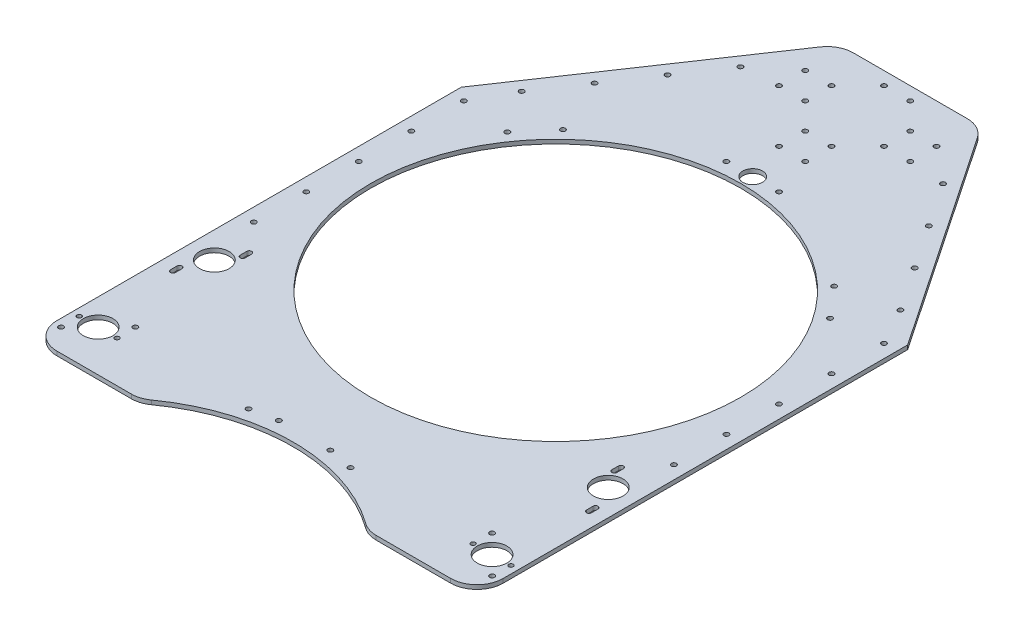
from build123d import *

# Parameters (mm, degrees)
SKETCH1_W           = 431.8
SKETCH1_H           = 685.8
BOSS_EXTRUDE1_DEPTH = 4
SKETCH2_R           = 14.3129
SKETCH2_R_2         = 2.38125
SKETCH2_R_3         = 2.159
CUT_EXTRUDE1_DEPTH  = 406.227368276
SKETCH6_R           = 179.07
CUT_EXTRUDE4_DEPTH  = 406.227368276
SKETCH8_R           = 9.525
SKETCH8_R_2         = 2.38125
CUT_EXTRUDE6_DEPTH  = 406.227368276
FILLET2_R           = 25.4
SKETCH11_R          = 2.38125
CUT_EXTRUDE9_DEPTH  = 406.227368276
SKETCH13_R          = 2.38125
SKETCH13_R_2        = 2.466421692
SKETCH13_R_3        = 2.307769972
CUT_EXTRUDE10_DEPTH = 406.227368276
SKETCH16_W          = 431.8
SKETCH16_H          = 50.8
CUT_EXTRUDE13_DEPTH = 406.227368276
SKETCH17_R          = 177.8
SKETCH17_R_2        = 2.38125
CUT_EXTRUDE14_DEPTH = 406.227368276
FILLET3_R           = 25.4
SKETCH18_R          = 2.38125
CUT_EXTRUDE15_DEPTH = 406.227368276
CHAMFER1_SIZE       = 147.32
CHAMFER1_SIZE2      = 218.410881881
CHAMFER2_SIZE       = 147.32
CHAMFER2_SIZE2      = 218.410881881
FILLET4_R           = 25.4
SKETCH19_R          = 2.38125
CUT_EXTRUDE16_DEPTH = 406.227368276


with BuildPart() as part:
    # Sketch1 → Boss-Extrude1 (new body)
    with BuildSketch(Plane(origin=(0, 0, 0), x_dir=(1, 0, 0), z_dir=(0, 1, 0))):
        Rectangle(SKETCH1_W, SKETCH1_H)
    extrude(amount=BOSS_EXTRUDE1_DEPTH)

    # Sketch2 → Cut-Extrude1 (cut, through all)
    with BuildSketch(Plane(origin=(0, 4, 0), x_dir=(1, 0, 0), z_dir=(0, 1, 0))):
        with BuildLine():
            Line((198.853253848, -213.520217791), (198.853253848, -219.870217791))
            ThreePointArc((198.853253848, -219.870217791), (201.234503848, -222.251467791), (203.615753848, -219.870217791))
            Line((203.615753848, -219.870217791), (203.615753848, -213.520217791))
            ThreePointArc((203.615753848, -213.520217791), (201.234503848, -211.138967791), (198.853253848, -213.520217791))
        make_face()
        with BuildLine():
            Line((177.384246152, -167.479782209), (177.384246152, -173.829782209))
            ThreePointArc((177.384246152, -173.829782209), (179.765496152, -176.211032209), (182.146746152, -173.829782209))
            Line((182.146746152, -173.829782209), (182.146746152, -167.479782209))
            ThreePointArc((182.146746152, -167.479782209), (179.765496152, -165.098532209), (177.384246152, -167.479782209))
        make_face()
        with BuildLine():
            Line((-203.615753848, -213.520217791), (-203.615753848, -219.870217791))
            ThreePointArc((-203.615753848, -219.870217791), (-201.234503848, -222.251467791), (-198.853253848, -219.870217791))
            Line((-198.853253848, -219.870217791), (-198.853253848, -213.520217791))
            ThreePointArc((-198.853253848, -213.520217791), (-201.234503848, -211.138967791), (-203.615753848, -213.520217791))
        make_face()
        with BuildLine():
            Line((-182.146746152, -167.479782209), (-182.146746152, -173.829782209))
            ThreePointArc((-182.146746152, -173.829782209), (-179.765496152, -176.211032209), (-177.384246152, -173.829782209))
            Line((-177.384246152, -173.829782209), (-177.384246152, -167.479782209))
            ThreePointArc((-177.384246152, -167.479782209), (-179.765496152, -165.098532209), (-182.146746152, -167.479782209))
        make_face()
        with Locations((-190.5, -302.895)):
            Circle(SKETCH2_R)
        with Locations((-190.5, -190.5)):
            Circle(SKETCH2_R)
        with Locations((190.5, -190.5)):
            Circle(SKETCH2_R)
        with Locations((-208.460512242, -320.855512242)):
            Circle(SKETCH2_R_2)
        with Locations((-172.539487758, -284.934487758)):
            Circle(SKETCH2_R_2)
        with Locations((172.539487758, -284.934487758)):
            Circle(SKETCH2_R_2)
        with Locations((208.460512242, -320.855512242)):
            Circle(SKETCH2_R_2)
        with Locations((190.5, -302.895)):
            Circle(SKETCH2_R)
        with Locations((208.788, -302.895)):
            Circle(SKETCH2_R_3)
        with Locations((172.212, -302.895)):
            Circle(SKETCH2_R_3)
        with Locations((-172.212, -302.895)):
            Circle(SKETCH2_R_3)
        with Locations((-208.788, -302.895)):
            Circle(SKETCH2_R_3)
    extrude(amount=-CUT_EXTRUDE1_DEPTH, mode=Mode.SUBTRACT)

    # Sketch6 → Cut-Extrude4 (cut, through all)
    with BuildSketch(Plane(origin=(0, 4, 0), x_dir=(1, 0, 0), z_dir=(0, 1, 0))):
        with Locations((0, -50.8)):
            Circle(SKETCH6_R)
    extrude(amount=-CUT_EXTRUDE4_DEPTH, mode=Mode.SUBTRACT)

    # Sketch8 → Cut-Extrude6 (cut, through all)
    with BuildSketch(Plane(origin=(0, 4, 0), x_dir=(1, 0, 0), z_dir=(0, 1, 0))):
        with Locations((0, 139.7)):
            Circle(SKETCH8_R)
        with Locations((25.4, 139.7)):
            Circle(SKETCH8_R_2)
        with Locations((-25.4, 139.7)):
            Circle(SKETCH8_R_2)
    extrude(amount=-CUT_EXTRUDE6_DEPTH, mode=Mode.SUBTRACT)

    # Fillet2
    fillet2_edges = [part.edges().sort_by_distance(p)[0] for p in [
        (215.9, 2, 342.9),
        (-215.9, 2, 342.9),
    ]]
    fillet(fillet2_edges, radius=FILLET2_R)

    # Sketch11 → Cut-Extrude9 (cut, through all)
    with BuildSketch(Plane(origin=(0, 4, 0), x_dir=(1, 0, 0), z_dir=(0, 1, 0))):
        with Locations((156.048464437, 58.466311125)):
            Circle(SKETCH11_R)
        with Locations((131.183773775, 87.334237241)):
            Circle(SKETCH11_R)
        with Locations((-131.183773775, 87.334237241)):
            Circle(SKETCH11_R)
        with Locations((-156.048464437, 58.466311125)):
            Circle(SKETCH11_R)
    extrude(amount=-CUT_EXTRUDE9_DEPTH, mode=Mode.SUBTRACT)

    # Sketch13 → Cut-Extrude10 (cut, through all)
    with BuildSketch(Plane(origin=(0, 4, 0), x_dir=(1, 0, 0), z_dir=(0, 1, 0))):
        with Locations((-203.2, 317.5)):
            Circle(SKETCH13_R)
        with Locations((-203.2, 266.7)):
            Circle(SKETCH13_R)
        with Locations((-203.2, 215.9)):
            Circle(SKETCH13_R)
        with Locations((-203.2, 165.1)):
            Circle(SKETCH13_R)
        with Locations((-203.2, 114.3)):
            Circle(SKETCH13_R)
        with Locations((-203.2, 63.5)):
            Circle(SKETCH13_R)
        with Locations((-203.2, 12.7)):
            Circle(SKETCH13_R)
        with Locations((-203.2, -38.1)):
            Circle(SKETCH13_R)
        with Locations((-203.2, -88.9)):
            Circle(SKETCH13_R)
        with Locations((-203.2, -139.7)):
            Circle(SKETCH13_R)
        with Locations((203.2, -139.7)):
            Circle(SKETCH13_R)
        with Locations((203.2, 12.7)):
            Circle(SKETCH13_R)
        with Locations((203.2, 63.5)):
            Circle(SKETCH13_R)
        with Locations((203.2, 114.3)):
            Circle(SKETCH13_R)
        with Locations((203.2, 165.1)):
            Circle(SKETCH13_R)
        with Locations((203.2, 266.7)):
            Circle(SKETCH13_R)
        with Locations((203.2, 317.5)):
            Circle(SKETCH13_R)
        with Locations((-25.4, -330.2)):
            Circle(SKETCH13_R_2)
        with Locations((-50.8, -330.2)):
            Circle(SKETCH13_R_3)
        with Locations((50.8, -330.2)):
            Circle(SKETCH13_R_3)
        with Locations((25.4, -330.2)):
            Circle(SKETCH13_R_2)
        with Locations((203.2, -88.9)):
            Circle(SKETCH13_R)
        with Locations((203.2, -38.1)):
            Circle(SKETCH13_R)
        with Locations((203.2, 215.9)):
            Circle(SKETCH13_R)
    extrude(amount=-CUT_EXTRUDE10_DEPTH, mode=Mode.SUBTRACT)

    # Sketch16 → Cut-Extrude13 (cut, through all)
    with BuildSketch(Plane(origin=(0, 4, 0), x_dir=(1, 0, 0), z_dir=(0, 1, 0))):
        with Locations((0, 317.5)):
            Rectangle(SKETCH16_W, SKETCH16_H)
    extrude(amount=-CUT_EXTRUDE13_DEPTH, mode=Mode.SUBTRACT)

    # Sketch17 → Cut-Extrude14 (cut, through all)
    with BuildSketch(Plane(origin=(0, 0, 0), x_dir=(-1, 0, 0), z_dir=(0, -1, 0))):
        with Locations((0, -482.6)):
            Circle(SKETCH17_R)
        with Locations((24.865239618, -293.729753908)):
            Circle(SKETCH17_R_2)
        with Locations((49.305028092, -298.591130092)):
            Circle(SKETCH17_R_2)
        with Locations((-24.865239618, -293.729753908)):
            Circle(SKETCH17_R_2)
        with Locations((-49.305028092, -298.591130092)):
            Circle(SKETCH17_R_2)
    extrude(amount=-CUT_EXTRUDE14_DEPTH, mode=Mode.SUBTRACT)

    # Fillet3
    fillet3_edges = [part.edges().sort_by_distance(p)[0] for p in [
        (109.985226281, 2, 342.9),
        (-109.985226281, 2, 342.9),
    ]]
    fillet(fillet3_edges, radius=FILLET3_R)

    # Sketch18 → Cut-Extrude15 (cut, through all)
    with BuildSketch(Plane(origin=(0, 4, 0), x_dir=(1, 0, 0), z_dir=(0, 1, 0))):
        with Locations((38.1, 228.6)):
            Circle(SKETCH18_R)
        with Locations((63.5, 228.6)):
            Circle(SKETCH18_R)
        with Locations((63.5, 254)):
            Circle(SKETCH18_R)
        with Locations((38.1, 254)):
            Circle(SKETCH18_R)
        with Locations((-12.7, 177.8)):
            Circle(SKETCH18_R)
        with Locations((-12.7, 203.2)):
            Circle(SKETCH18_R)
        with Locations((12.7, 177.8)):
            Circle(SKETCH18_R)
        with Locations((12.7, 203.2)):
            Circle(SKETCH18_R)
        with Locations((-63.5, 254)):
            Circle(SKETCH18_R)
        with Locations((-38.1, 254)):
            Circle(SKETCH18_R)
        with Locations((-63.5, 228.6)):
            Circle(SKETCH18_R)
        with Locations((-38.1, 228.6)):
            Circle(SKETCH18_R)
        with Locations((12.7, 304.8)):
            Circle(SKETCH18_R)
        with Locations((12.7, 279.4)):
            Circle(SKETCH18_R)
        with Locations((-12.7, 304.8)):
            Circle(SKETCH18_R)
        with Locations((-12.7, 279.4)):
            Circle(SKETCH18_R)
    extrude(amount=-CUT_EXTRUDE15_DEPTH, mode=Mode.SUBTRACT)

    # Chamfer1
    chamfer1_edges = [part.edges().sort_by_distance(p)[0] for p in [
        (215.9, 2, -292.1),
    ]]
    chamfer1_side = [part.faces().sort_by_distance(p)[0] for p in [
        (0, 2, -292.1),
    ]]
    chamfer(chamfer1_edges, length=CHAMFER1_SIZE, length2=CHAMFER1_SIZE2, reference=chamfer1_side[0])

    # Chamfer2
    chamfer2_edges = [part.edges().sort_by_distance(p)[0] for p in [
        (-215.9, 2, -292.1),
    ]]
    chamfer2_side = [part.faces().sort_by_distance(p)[0] for p in [
        (-73.66, 2, -292.1),
    ]]
    chamfer(chamfer2_edges, length=CHAMFER2_SIZE, length2=CHAMFER2_SIZE2, reference=chamfer2_side[0])

    # Fillet4
    fillet4_edges = [part.edges().sort_by_distance(p)[0] for p in [
        (68.58, 2, -292.1),
        (-68.58, 2, -292.1),
    ]]
    fillet(fillet4_edges, radius=FILLET4_R)

    # Sketch19 → Cut-Extrude16 (cut, through all)
    with BuildSketch(Plane(origin=(0, 4, 0), x_dir=(1, 0, 0), z_dir=(0, 1, 0))):
        with Locations((-97.97689967, 225.806)):
            Circle(SKETCH19_R)
        with Locations((-126.383899166, 183.690891314)):
            Circle(SKETCH19_R)
        with Locations((-154.790898662, 141.575782628)):
            Circle(SKETCH19_R)
        with Locations((-183.197898158, 99.460673943)):
            Circle(SKETCH19_R)
        with Locations((183.197898158, 99.460673943)):
            Circle(SKETCH19_R)
        with Locations((154.790898662, 141.575782628)):
            Circle(SKETCH19_R)
        with Locations((126.383899166, 183.690891314)):
            Circle(SKETCH19_R)
        with Locations((97.97689967, 225.806)):
            Circle(SKETCH19_R)
    extrude(amount=-CUT_EXTRUDE16_DEPTH, mode=Mode.SUBTRACT)


solid = part.part
